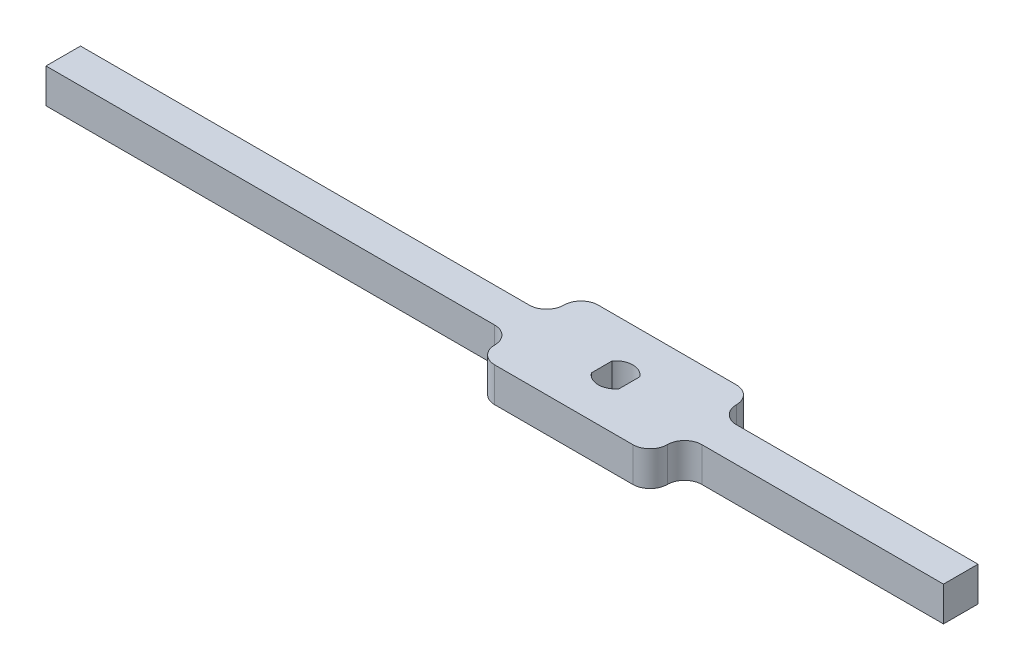
from build123d import *

# Parameters (mm, degrees)
SKETCH1_W           = 50
SKETCH1_H           = 30
BOSS_EXTRUDE1_DEPTH = 10
SKETCH2_W           = 135
SKETCH2_H           = 10
SKETCH2_W_2         = 75
BOSS_EXTRUDE3_DEPTH = 10
FILLET1_R           = 5
FILLET2_R           = 5


with BuildPart() as part:
    # Sketch1 → Boss-Extrude1 (new body)
    with BuildSketch(Plane(origin=(0, 0, 0), x_dir=(1, 0, 0), z_dir=(0, 1, 0))):
        Rectangle(SKETCH1_W, SKETCH1_H)
        with BuildLine():
            Line((-4, 3), (-4, -3))
            ThreePointArc((-4, -3), (0, -5), (4, -3))
            Line((4, -3), (4, 3))
            ThreePointArc((4, 3), (0, 5), (-4, 3))
        make_face(mode=Mode.SUBTRACT)
    extrude(amount=BOSS_EXTRUDE1_DEPTH)

    # Sketch2 → Boss-Extrude3 (add)
    with BuildSketch(Plane.XZ):
        with Locations((-92.5, 0)):
            Rectangle(SKETCH2_W, SKETCH2_H)
        with Locations((62.5, 0)):
            Rectangle(SKETCH2_W_2, SKETCH2_H)
    extrude(amount=-BOSS_EXTRUDE3_DEPTH)

    # Fillet1
    fillet1_edges = [part.edges().sort_by_distance(p)[0] for p in [
        (-25, 5, 5),
        (-25, 5, -5),
        (25, 5, -5),
        (25, 5, 5),
    ]]
    fillet(fillet1_edges, radius=FILLET1_R)

    # Fillet2
    fillet2_edges = [part.edges().sort_by_distance(p)[0] for p in [
        (25, 5, 15),
        (-25, 5, 15),
        (-25, 5, -15),
        (25, 5, -15),
    ]]
    fillet(fillet2_edges, radius=FILLET2_R - 0.0001)  # a hair under: the kernel refuses the full size


solid = part.part
